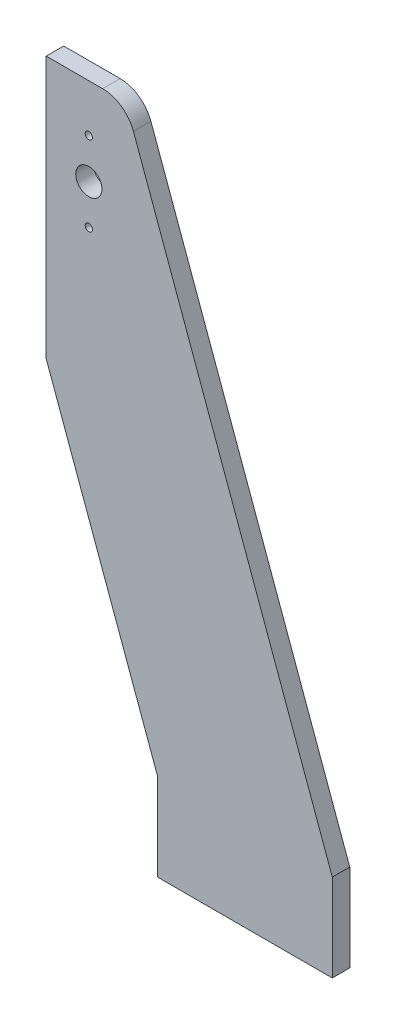
from build123d import *

# Parameters (mm, degrees)
SALIENTE_EXTRUIR1_DEPTH                        = 8
CROQUIS2_R                                     = 6
CORTAR_EXTRUIR1_DEPTH                          = 311.586541885
PERFORADOR_PARA_ROSCAR_PARA_MACHO_DE_ROS_D     = 3.3
PERFORADOR_PARA_ROSCAR_PARA_MACHO_DE_ROS_DEPTH = 7
PERFORADOR_PARA_ROSCAR_PARA_MACHO_DE_ROS_TIP   = 0.991420021


with BuildPart() as part:
    # Croquis1 → Saliente-Extruir1 (new body)
    with BuildSketch(Plane.XY):
        with BuildLine():
            Line((80, 0), (80, 40))
            Line((80, 40), (-11.039984671, 290.13030215))
            ThreePointArc((-11.039984671, 290.13030215), (-16.531727437, 297.287280664), (-25.135373982, 300))
            Line((-25.135373982, 300), (-50.955832797, 300))
            Line((-50.955832797, 300), (-50.955832797, 180))
            Line((-50.955832797, 180), (0, 40))
            Line((0, 40), (0, 0))
            Line((0, 0), (80, 0))
        make_face()
    extrude(amount=SALIENTE_EXTRUIR1_DEPTH)

    # Croquis2 → Cortar-Extruir1 (cut, through all)
    with BuildSketch(Plane(origin=(0, 0, 0), x_dir=(-1, 0, 0), z_dir=(0, 0, -1))):
        with Locations((31.455832797, 260)):
            Circle(CROQUIS2_R)
    extrude(amount=-CORTAR_EXTRUIR1_DEPTH, mode=Mode.SUBTRACT)

    # Perforador para roscar para macho de roscar para M44
    with Locations(Plane.XY.offset(8)):
        with Locations((-31.455832797, 278.25), (-31.455832797, 241.75)):
            Hole(PERFORADOR_PARA_ROSCAR_PARA_MACHO_DE_ROS_D / 2, depth=PERFORADOR_PARA_ROSCAR_PARA_MACHO_DE_ROS_DEPTH)
            with Locations((0, 0, -(PERFORADOR_PARA_ROSCAR_PARA_MACHO_DE_ROS_DEPTH + PERFORADOR_PARA_ROSCAR_PARA_MACHO_DE_ROS_TIP / 2))):  # 118° drill point
                Cone(0, PERFORADOR_PARA_ROSCAR_PARA_MACHO_DE_ROS_D / 2, PERFORADOR_PARA_ROSCAR_PARA_MACHO_DE_ROS_TIP, mode=Mode.SUBTRACT)


solid = part.part
